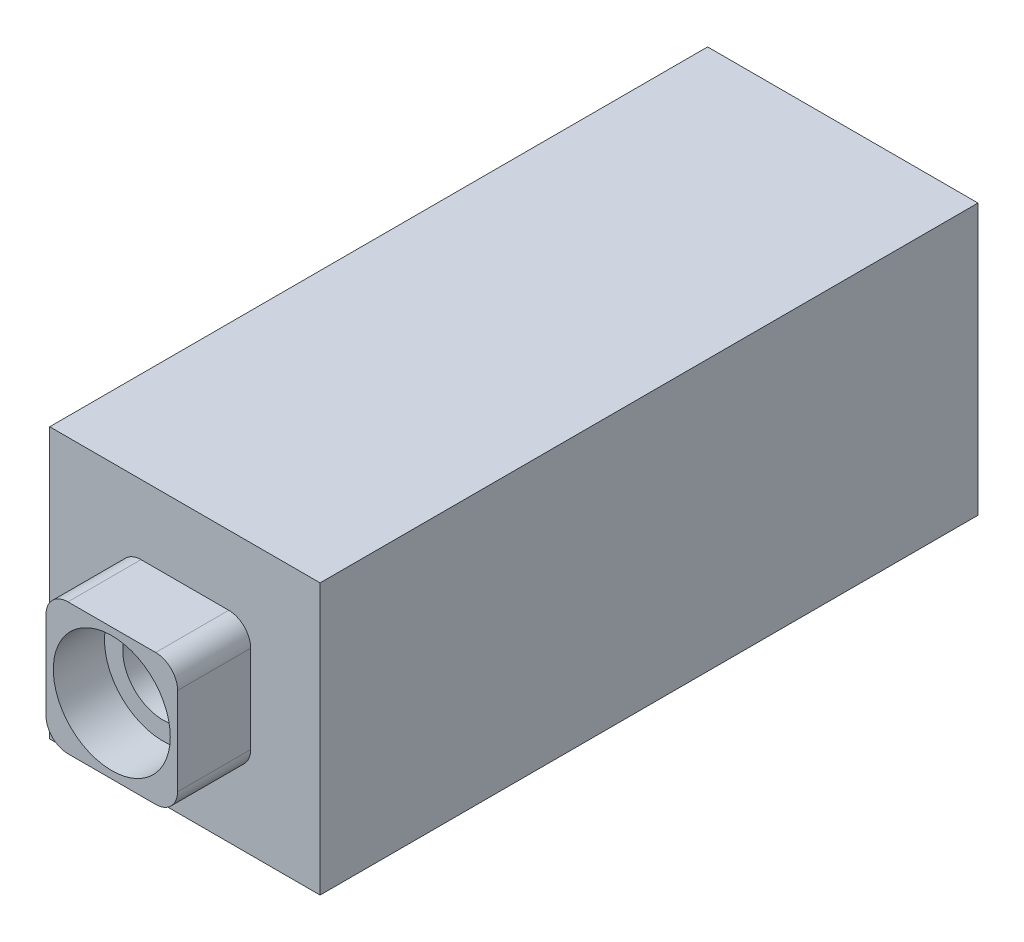
from build123d import *

# Parameters (mm, degrees)
SKETCH_1_W              = 18
SKETCH_1_H              = 18
EXTRUDE_2_DEPTH         = 10
EXTRUDE_3_DEPTH         = 90
CUT_EXTRUDE_3_DEPTH     = 86
CUT_EXTRUDE_START       = -100
CUT_EXTRUDE_5_OUTLINE_R = 5.5
CUT_EXTRUDE_5_DEPTH     = 93
SKETCH_7_R              = 8
CUT_EXTRUDE_6_DEPTH     = 7
FILLET_6_R              = 3
FILLET_7_R              = 3
FILLET_8_R              = 3
FILLET_9_R              = 3


# Read off the part's stored shape, not the designer's step: 切除-拉伸5
with BuildPart() as part:
    # 草图1 → 凸台-拉伸2 (new body)
    with BuildSketch(Plane.XY):
        with Locations((-9, -9)):
            Rectangle(SKETCH_1_W, SKETCH_1_H)
    extrude(amount=-EXTRUDE_2_DEPTH)

    # Sketch 3D_1 → 凸台-拉伸3 (add)
    with BuildSketch(Plane(origin=(9.495592889, -27.495592889, -10), x_dir=(-0.7071067811865476, 0.7071067811865476, -9.817405728081993e-13), z_dir=(-1.3883908327972863e-12, 0, 1.0))):
        Polygon((0, 0), (26.156718308, 26.156718308), (52.313436617, 0), (26.156718308, -26.156718308), align=None)
    extrude(amount=-EXTRUDE_3_DEPTH)

    # 草图6 → 切除-拉伸3 (cut)
    with BuildSketch(Plane(origin=(0, 0, -100), x_dir=(-1.0, 0, -1.3537169902663766e-12), z_dir=(1.3537169902663766e-12, -3.467772761410138e-14, -1.0))):
        with BuildLine():
            ThreePointArc((20.610593598, -20.610593598), (1.033022784, 5.357543015), (12.708084345, -24.995683102))
            ThreePointArc((12.708084345, -24.995683102), (15.102764846, -21.155695433), (11.262777177, -18.761014932))
            ThreePointArc((11.262777177, -18.761014932), (4.138326818, -0.238624142), (16.085110199, -16.085110199))
            ThreePointArc((16.085110199, -16.085110199), (16.085110199, -20.610593598), (20.610593598, -20.610593598))
        make_face()
    extrude(amount=-CUT_EXTRUDE_3_DEPTH, mode=Mode.SUBTRACT)

    # 切除-拉伸5 outline → 切除-拉伸5 (cut)
    with BuildSketch(Plane.XY.offset(CUT_EXTRUDE_START)):
        with Locations((-9, -9)):
            Circle(CUT_EXTRUDE_5_OUTLINE_R)
    extrude(amount=CUT_EXTRUDE_5_DEPTH, mode=Mode.SUBTRACT)

    # 草图7 → 切除-拉伸6 (cut)
    with BuildSketch(Plane.XY):
        with Locations((-9, -9)):
            Circle(SKETCH_7_R)
    extrude(amount=-CUT_EXTRUDE_6_DEPTH, mode=Mode.SUBTRACT)

    # 圆角6
    fillet_6_edges = [part.edges().sort_by_distance(p)[0] for p in [
        (-18, 0, -5),
    ]]
    fillet(fillet_6_edges, radius=FILLET_6_R)

    # 圆角7
    fillet_7_edges = [part.edges().sort_by_distance(p)[0] for p in [
        (-18, -18, -5),
    ]]
    fillet(fillet_7_edges, radius=FILLET_7_R)

    # 圆角8
    fillet_8_edges = [part.edges().sort_by_distance(p)[0] for p in [
        (0, 0, -5),
    ]]
    fillet(fillet_8_edges, radius=FILLET_8_R)

    # 圆角9
    fillet_9_edges = [part.edges().sort_by_distance(p)[0] for p in [
        (0, -18, -5),
    ]]
    fillet(fillet_9_edges, radius=FILLET_9_R)


solid = part.part
